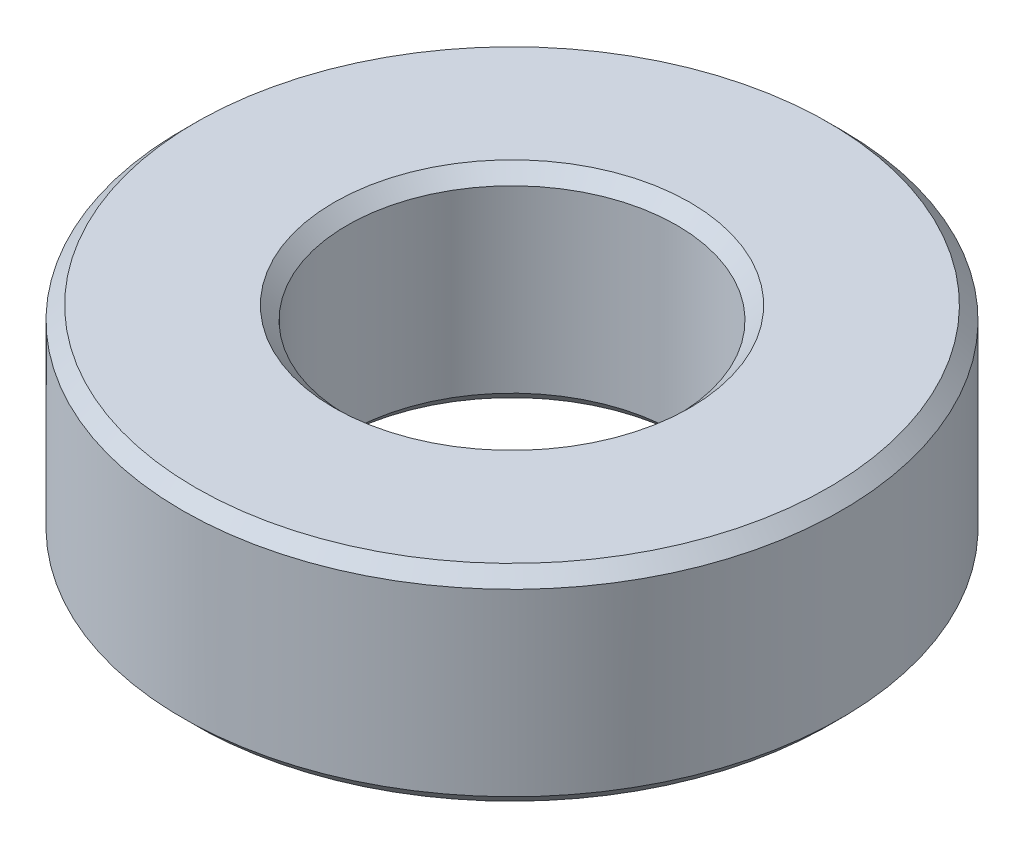
from build123d import *

# Parameters (mm, degrees)
SKETCH1_W     = 3.175
SKETCH1_H     = 3.96875
CHAMFER1_SIZE = 0.254


with BuildPart() as part:
    # Sketch1 → Revolve1 (revolve)
    with BuildSketch(Plane.XY):
        with Locations((4.7625, 0)):
            Rectangle(SKETCH1_W, SKETCH1_H)
    revolve(axis=Axis((0, -0.65258894, 0), (0, 1, 0)))

    # Chamfer1
    chamfer1_edges = [part.edges().sort_by_distance(p)[0] for p in [
        (-6.35, -1.984375, 0),
        (-6.35, 1.984375, 0),
        (-3.175, 1.984375, 0),
        (-3.175, -1.984375, 0),
    ]]
    chamfer(chamfer1_edges, length=CHAMFER1_SIZE)


solid = part.part
